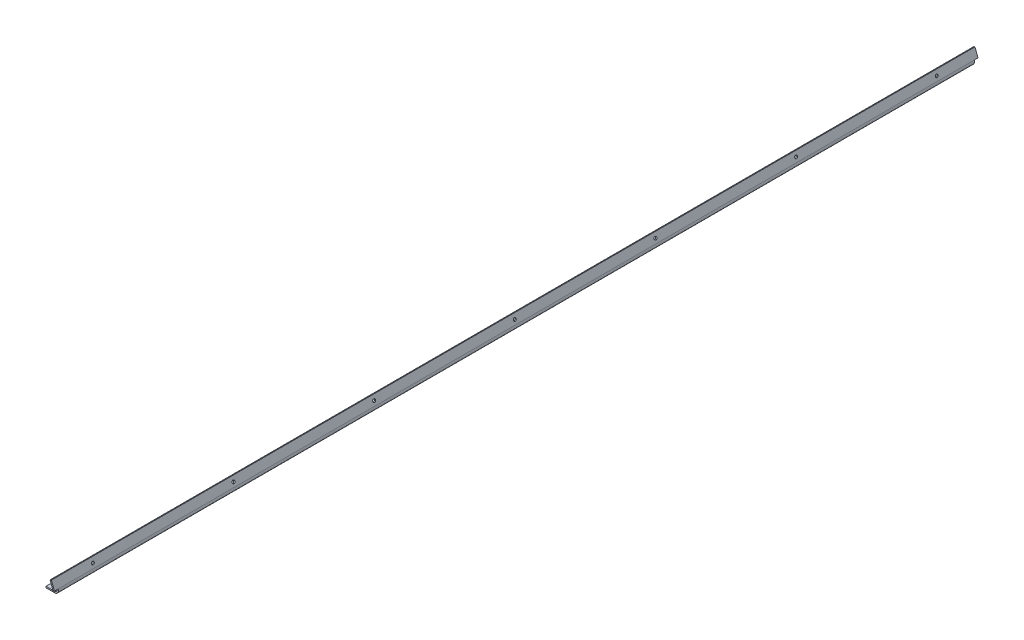
from build123d import *

# Parameters (mm, degrees)
SM_BASE_FLANGE_1_DEPTH = 985
CUT_EXTRUDE_START      = 977
CUT_EXTRUDE_1_DEPTH    = 8
CUT_EXTRUDE_2_REACH    = 987.857
SKETCH_4_RX            = 3
SKETCH_4_RY            = 2.999814796


# Read off the part's stored shape, not the designer's step: Вырез-Вытянуть1
# Sheet-metal steps are written as plain solids
with BuildPart() as part:
    # Sketch 1 → Базовая кромка1 (new, symmetric)
    with BuildSketch(Plane.XY):
        with BuildLine():
            Line((-10.573213138, 28.075027408), (-4.074693371, 10.819523503))
            ThreePointArc((-4.074693371, 10.819523503), (-4.982758525, 3.447867974), (-11.561367346, 0))
            Line((-11.561367346, 0), (-30, 0))
            Line((-30, 0), (-30, 3))
            Line((-30, 3), (-11.561367346, 3))
            ThreePointArc((-11.561367346, 3), (-7.449736833, 5.154917483), (-6.882196111, 9.76220219))
            Line((-6.882196111, 9.76220219), (-13.380715879, 27.017706094))
            Line((-13.380715879, 27.017706094), (-10.573213138, 28.075027408))
        make_face()
    extrude(amount=SM_BASE_FLANGE_1_DEPTH, both=True)

    # Вырез-Вытянуть1 outline → Вырез-Вытянуть1 (cut)
    with BuildSketch(Plane.XY.offset(CUT_EXTRUDE_START)):
        with BuildLine():
            Line((-4.074693371, 10.819523503), (-6.882196111, 9.76220219))
            ThreePointArc((-6.882196111, 9.76220219), (-7.449736833, 5.154917483), (-11.561367346, 3))
            Line((-11.561367346, 3), (-30, 3))
            Line((-30, 3), (-30, 0))
            Line((-30, 0), (-11.561367346, 0))
            ThreePointArc((-11.561367346, 0), (-4.982758526, 3.447867973), (-4.074693371, 10.819523503))
        make_face()
    cut_extrude_1 = extrude(amount=CUT_EXTRUDE_1_DEPTH, mode=Mode.SUBTRACT)

    # Зеркальное отражение1: Вырез-Вытянуть1 across plane
    add(cut_extrude_1.mirror(Plane.XY), mode=Mode.SUBTRACT)

    # Эскиз4 → Вырез-Вытянуть2 (cut, up to next)
    with BuildSketch(Plane(origin=(0, 0, 0), x_dir=(0, 0, -1), z_dir=(0.9358342469192185, 0.3524404379368797, 0)), mode=Mode.PRIVATE) as cut_extrude_2_sk1:
        with Locations(Location((600, 20.076859002), (0, 0, 180))):
            Ellipse(SKETCH_4_RX, SKETCH_4_RY)
    cut_extrude_2_tool1 = extrude(cut_extrude_2_sk1.sketch, amount=-CUT_EXTRUDE_2_REACH, mode=Mode.PRIVATE) & part.part
    # Эскиз4 → Вырез-Вытянуть2 (cut, up to next)
    with BuildSketch(Plane(origin=(0, 0, 0), x_dir=(0, 0, -1), z_dir=(0.9358342469192185, 0.3524404379368797, 0)), mode=Mode.PRIVATE) as cut_extrude_2_sk2:
        with Locations(Location((300, 20.076859002), (0, 0, 180))):
            Ellipse(SKETCH_4_RX, SKETCH_4_RY)
    cut_extrude_2_tool2 = extrude(cut_extrude_2_sk2.sketch, amount=-CUT_EXTRUDE_2_REACH, mode=Mode.PRIVATE) & part.part
    # Эскиз4 → Вырез-Вытянуть2 (cut, up to next)
    with BuildSketch(Plane(origin=(0, 0, 0), x_dir=(0, 0, -1), z_dir=(0.9358342469192185, 0.3524404379368797, 0)), mode=Mode.PRIVATE) as cut_extrude_2_sk3:
        with Locations(Location((0, 20.076859002), (0, 0, 180))):
            Ellipse(SKETCH_4_RX, SKETCH_4_RY)
    cut_extrude_2_tool3 = extrude(cut_extrude_2_sk3.sketch, amount=-CUT_EXTRUDE_2_REACH, mode=Mode.PRIVATE) & part.part
    # Эскиз4 → Вырез-Вытянуть2 (cut, up to next)
    with BuildSketch(Plane(origin=(0, 0, 0), x_dir=(0, 0, -1), z_dir=(0.9358342469192185, 0.3524404379368797, 0)), mode=Mode.PRIVATE) as cut_extrude_2_sk4:
        with Locations((-300, 20.076859002)):
            Ellipse(SKETCH_4_RX, SKETCH_4_RY)
    cut_extrude_2_tool4 = extrude(cut_extrude_2_sk4.sketch, amount=-CUT_EXTRUDE_2_REACH, mode=Mode.PRIVATE) & part.part
    # Эскиз4 → Вырез-Вытянуть2 (cut, up to next)
    with BuildSketch(Plane(origin=(0, 0, 0), x_dir=(0, 0, -1), z_dir=(0.9358342469192185, 0.3524404379368797, 0)), mode=Mode.PRIVATE) as cut_extrude_2_sk5:
        with Locations((-600, 20.076859002)):
            Ellipse(SKETCH_4_RX, SKETCH_4_RY)
    cut_extrude_2_tool5 = extrude(cut_extrude_2_sk5.sketch, amount=-CUT_EXTRUDE_2_REACH, mode=Mode.PRIVATE) & part.part
    # Эскиз4 → Вырез-Вытянуть2 (cut, up to next)
    with BuildSketch(Plane(origin=(0, 0, 0), x_dir=(0, 0, -1), z_dir=(0.9358342469192185, 0.3524404379368797, 0)), mode=Mode.PRIVATE) as cut_extrude_2_sk6:
        with Locations((-900, 20.076859002)):
            Ellipse(SKETCH_4_RX, SKETCH_4_RY)
    cut_extrude_2_tool6 = extrude(cut_extrude_2_sk6.sketch, amount=-CUT_EXTRUDE_2_REACH, mode=Mode.PRIVATE) & part.part
    # Эскиз4 → Вырез-Вытянуть2 (cut, up to next)
    with BuildSketch(Plane(origin=(0, 0, 0), x_dir=(0, 0, -1), z_dir=(0.9358342469192185, 0.3524404379368797, 0)), mode=Mode.PRIVATE) as cut_extrude_2_sk7:
        with Locations(Location((900, 20.076859002), (0, 0, 180))):
            Ellipse(SKETCH_4_RX, SKETCH_4_RY)
    cut_extrude_2_tool7 = extrude(cut_extrude_2_sk7.sketch, amount=-CUT_EXTRUDE_2_REACH, mode=Mode.PRIVATE) & part.part
    add(cut_extrude_2_tool1.solids().sort_by_distance((-7.075897, 18.788612, -600))[0], mode=Mode.SUBTRACT)
    add(cut_extrude_2_tool2.solids().sort_by_distance((-7.075897, 18.788612, -300))[0], mode=Mode.SUBTRACT)
    add(cut_extrude_2_tool3.solids().sort_by_distance((-7.075897, 18.788612, 0))[0], mode=Mode.SUBTRACT)
    add(cut_extrude_2_tool4.solids().sort_by_distance((-7.075897, 18.788612, 300))[0], mode=Mode.SUBTRACT)
    add(cut_extrude_2_tool5.solids().sort_by_distance((-7.075897, 18.788612, 600))[0], mode=Mode.SUBTRACT)
    add(cut_extrude_2_tool6.solids().sort_by_distance((-7.075897, 18.788612, 900))[0], mode=Mode.SUBTRACT)
    add(cut_extrude_2_tool7.solids().sort_by_distance((-7.075897, 18.788612, -900))[0], mode=Mode.SUBTRACT)


solid = part.part
